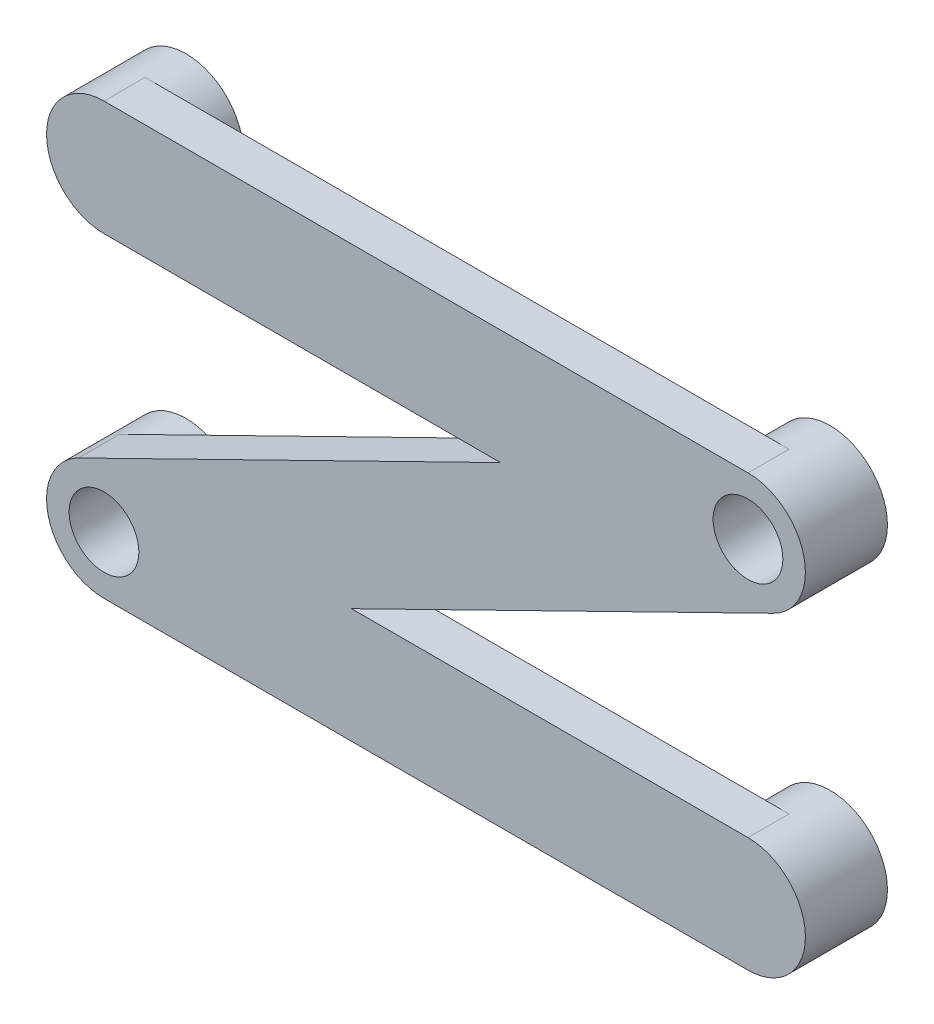
from build123d import *

# Parameters (mm, degrees)
EXTRUDE_1010_DEPTH = 2
SKETCH_1_5_R       = 2.8
SKETCH_1_5_R_2     = 1.7
EXTRUDE_1082_DEPTH = 4


with BuildPart() as part:
    # Эскиз1 → Extrude 1010 (new body)
    with BuildSketch(Plane.XY):
        with BuildLine():
            Line((15.7, 10.5), (-15.7, 10.5))
            ThreePointArc((-15.7, 10.5), (-13.720101013, 9.679898987), (-12.9, 7.7))
            ThreePointArc((-12.9, 7.7), (-13.720101013, 5.720101013), (-15.7, 4.9))
            Line((-15.7, 4.9), (3.632157719, 4.9))
            Line((3.632157719, 4.9), (-16.932946461, -5.186070203))
            ThreePointArc((-16.932946461, -5.186070203), (-14.218826494, -5.323842378), (-12.9, -7.7))
            ThreePointArc((-12.9, -7.7), (-13.720101013, -9.679898987), (-15.7, -10.5))
            Line((-15.7, -10.5), (15.7, -10.5))
            ThreePointArc((15.7, -10.5), (12.9, -7.7), (15.7, -4.9))
            Line((15.7, -4.9), (-3.632157719, -4.9))
            Line((-3.632157719, -4.9), (16.932946461, 5.186070203))
            ThreePointArc((16.932946461, 5.186070203), (12.972455002, 7.067150662), (15.7, 10.5))
        make_face()
    extrude(amount=-EXTRUDE_1010_DEPTH)

    # Эскиз1<5> → Extrude 1082 (add)
    # profile 1 of 4: a face of its own
    with BuildSketch(Plane.XY):
        with Locations((-15.7, 7.7)):
            Circle(SKETCH_1_5_R)
    # profile 2 of 4: a face of its own
    with BuildSketch(Plane.XY):
        with Locations((15.7, 7.7)):
            Circle(SKETCH_1_5_R)
        with Locations((15.7, 7.7)):
            Circle(SKETCH_1_5_R_2, mode=Mode.SUBTRACT)
    # profile 3 of 4: a face of its own
    with BuildSketch(Plane.XY):
        with Locations((-15.7, -7.7)):
            Circle(SKETCH_1_5_R)
        with Locations((-15.7, -7.7)):
            Circle(SKETCH_1_5_R_2, mode=Mode.SUBTRACT)
    # profile 4 of 4: a face of its own
    with BuildSketch(Plane.XY):
        with Locations((15.7, -7.7)):
            Circle(SKETCH_1_5_R)
    extrude(amount=-EXTRUDE_1082_DEPTH)


solid = part.part
